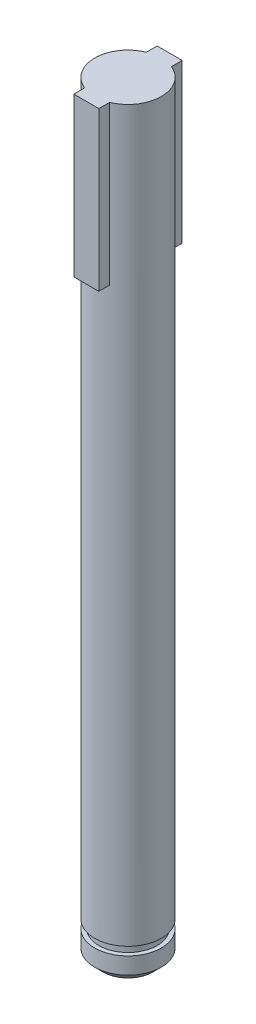
from build123d import *

# Parameters (mm, degrees)
BOSS_EXTRU_1_DEPTH      = 8
BOSS_EXTRU_1_DEPTH_BACK = 83.5
ESQUISSE1_R             = 4
ESQUISSE2_W             = 3
ESQUISSE2_H             = 10
BOSS_EXTRU_2_DEPTH      = 19
CHANFREIN1_SIZE         = 1
ENL_V_START             = -3
ESQUISSE3_R             = 4
ESQUISSE3_R_2           = 3.5
ENL_V_MAT_EXTRU_1_DEPTH = 1


with BuildPart() as part:
    # Esquisse1 → Boss.-Extru.1 (new, two sides: drawn at the far end of the back side and taken through both)
    with BuildSketch(Plane(origin=(0, 0, 0), x_dir=(1, 0, 0), z_dir=(0, 1, 0)).offset(-BOSS_EXTRU_1_DEPTH_BACK)):
        Circle(ESQUISSE1_R)
    extrude(amount=BOSS_EXTRU_1_DEPTH + BOSS_EXTRU_1_DEPTH_BACK)

    # Esquisse2 → Boss.-Extru.2 (add)
    with BuildSketch(Plane(origin=(0, 8, 0), x_dir=(1, 0, 0), z_dir=(0, 1, 0))):
        Rectangle(ESQUISSE2_W, ESQUISSE2_H)
    extrude(amount=-BOSS_EXTRU_2_DEPTH)

    # Chanfrein1
    chanfrein1_edges = [part.edges().sort_by_distance(p)[0] for p in [
        (-4, -83.5, 0),
    ]]
    chamfer(chanfrein1_edges, length=CHANFREIN1_SIZE)

    # Esquisse3 → Enlèv. mat.-Extru.1 (cut)
    with BuildSketch(Plane.XZ.offset(83.5).offset(ENL_V_START)):
        Circle(ESQUISSE3_R)
        Circle(ESQUISSE3_R_2, mode=Mode.SUBTRACT)
    extrude(amount=-ENL_V_MAT_EXTRU_1_DEPTH, mode=Mode.SUBTRACT)


solid = part.part
